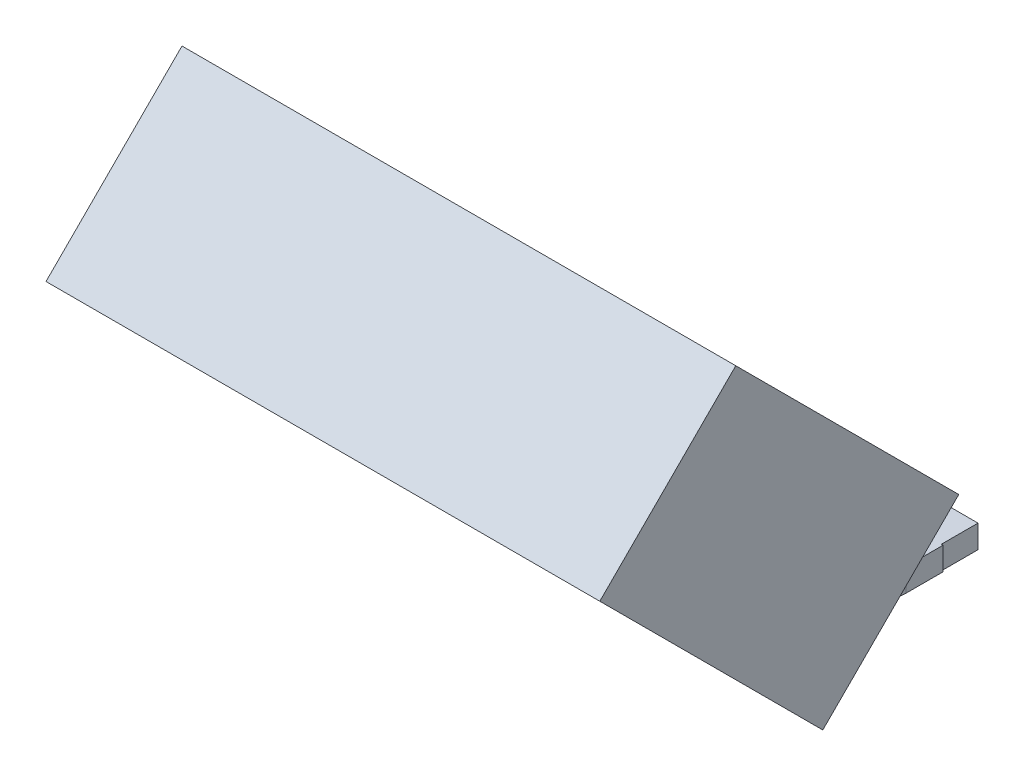
from build123d import *

# Parameters (mm, degrees)
ESQUISSE2_W          = 7.2
ESQUISSE2_H          = 2.5
BOITIER_DEPTH        = 4.1
FENETRECAPTEUR_START = -1.45
ESQUISSE4_R          = 0.8
FENETRECAPTEUR_DEPTH = 0.1
PATTES_DEPTH         = 0.15
PLIAGE_START         = -5
PLIAGE_1_OUTLINE_W   = 7.2
PLIAGE_1_OUTLINE_H   = 4.1
PLIAGE_1_DEPTH       = 4.301040764
PLIAGE_START_2       = -0.698959236
PLIAGE_1_2_OUTLINE_R = 0.8
PLIAGE_1_2_DEPTH     = 0.1
PLIAGE_START_3       = -0.598959236
PLIAGE_1_3_OUTLINE_W = 7.2
PLIAGE_1_3_OUTLINE_H = 4.1
PLIAGE_1_3_DEPTH     = 2.4
PLIAGE_1_4_OUTLINE_W = 7.2
PLIAGE_1_4_OUTLINE_H = 4.1
PLIAGE_1_4_OUTLINE_R = 0.8
PLIAGE_1_4_DEPTH     = 0.1
PLIAGE_START_4       = -3.6
PLIAGE_1_5_DEPTH     = 7.2
PLIAGE_START_5       = -2.813242849
PLIAGE_1_6_DEPTH     = 0.546485698
PLIAGE_START_6       = -1.543242849
PLIAGE_1_7_DEPTH     = 0.546485698
PLIAGE_START_7       = 0.996757151
PLIAGE_1_8_DEPTH     = 0.546485698
PLIAGE_START_8       = 2.266757151
PLIAGE_1_9_DEPTH     = 0.546485698
PLIAGE_START_9       = 0.601040763
PLIAGE_1_10_DEPTH    = 0.300000001


with BuildPart() as part:
    # Esquisse2 → Boitier (new body)
    with BuildSketch(Plane.XY):
        with Locations((0, -0.2)):
            Rectangle(ESQUISSE2_W, ESQUISSE2_H)
    extrude(amount=BOITIER_DEPTH)

    # Esquisse4 → FenetreCapteur (cut)
    with BuildSketch(Plane(origin=(0, 0, 0), x_dir=(1, 0, 0), z_dir=(0, 1, 0)).offset(FENETRECAPTEUR_START)):
        with Locations(Location((-1.27, -2.3, 0), (0, 0, 180))):
            Circle(ESQUISSE4_R)
        with Locations(Location((1.27, -2.3, 0), (0, 0, 180))):
            Circle(ESQUISSE4_R)
    extrude(amount=FENETRECAPTEUR_DEPTH, mode=Mode.SUBTRACT)

    # Esquisse5 → Pattes (add, symmetric)
    with BuildSketch(Plane(origin=(0, 0, 0), x_dir=(1, 0, 0), z_dir=(0, 1, 0))):
        Polygon((2.791437744, 2.2), (2.283797649, 2.2), (2.283797649, 1.724539267), (2.266757151, 1.724539267), (2.266757151, 0.7), (2.002499851, 0), (2.991852509, 0), (2.813242849, 0.7), (2.813242849, 1.724539267), (2.791437744, 1.724539267), align=None)
        Polygon((1.526202351, 2.2), (1.018562256, 2.2), (1.018562256, 1.724539267), (0.996757151, 1.724539267), (0.996757151, 0.7), (0.818147491, 0), (1.807500149, 0), (1.543242849, 0.7), (1.543242849, 1.724539267), (1.526202351, 1.724539267), align=None)
        Polygon((-1.018562256, 2.2), (-1.526202351, 2.2), (-1.526202351, 1.724539267), (-1.543242849, 1.724539267), (-1.543242849, 0.7), (-1.807500149, 0), (-0.818147491, 0), (-0.996757151, 0.7), (-0.996757151, 1.724539267), (-1.018562256, 1.724539267), align=None)
        Polygon((-2.283797649, 2.2), (-2.791437744, 2.2), (-2.791437744, 1.724539267), (-2.813242849, 1.724539267), (-2.813242849, 0.7), (-2.991852509, 0), (-2.002499851, 0), (-2.266757151, 0.7), (-2.266757151, 1.724539267), (-2.283797649, 1.724539267), align=None)
    extrude(amount=PATTES_DEPTH, both=True)

    # Pliage 1: read off the stored shape, not the designer's step
    # Pliage 1 outline → Pliage 1 (cut)
    with BuildSketch(Plane(origin=(0, 0, 0), x_dir=(1, 0, 0), z_dir=(0, 0.707106781186546, -0.707106781186549)).offset(PLIAGE_START)):
        with Locations((0, -2.236827202)):
            Rectangle(PLIAGE_1_OUTLINE_W, PLIAGE_1_OUTLINE_H)
    extrude(amount=PLIAGE_1_DEPTH, mode=Mode.SUBTRACT)

    # Pliage 1 2 outline → Pliage 1 2 (cut)
    with BuildSketch(Plane(origin=(0, 0, 0), x_dir=(1, 0, 0), z_dir=(0, 0.707106781186546, -0.707106781186549)).offset(PLIAGE_START_2)):
        with Locations((-1.27, -2.486827202)):
            Circle(PLIAGE_1_2_OUTLINE_R)
        with Locations((1.27, -2.486827202)):
            Circle(PLIAGE_1_2_OUTLINE_R)
    extrude(amount=PLIAGE_1_2_DEPTH, mode=Mode.SUBTRACT)

    # Pliage 1 3 outline → Pliage 1 3 (add)
    with BuildSketch(Plane(origin=(0, 0, 0), x_dir=(1, 0, 0), z_dir=(0, 0.707106781186546, -0.707106781186549)).offset(PLIAGE_START_3)):
        with Locations((0, -2.236827202)):
            Rectangle(PLIAGE_1_3_OUTLINE_W, PLIAGE_1_3_OUTLINE_H)
    extrude(amount=PLIAGE_1_3_DEPTH)

    # Pliage 1 4 outline → Pliage 1 4 (add)
    with BuildSketch(Plane(origin=(0, 0, 0), x_dir=(1, 0, 0), z_dir=(0, 0.707106781186546, -0.707106781186549)).offset(PLIAGE_START_2)):
        with Locations((0, -2.236827202)):
            Rectangle(PLIAGE_1_4_OUTLINE_W, PLIAGE_1_4_OUTLINE_H)
        with Locations((-1.27, -2.486827202)):
            Circle(PLIAGE_1_4_OUTLINE_R, mode=Mode.SUBTRACT)
        with Locations((1.27, -2.486827202)):
            Circle(PLIAGE_1_4_OUTLINE_R, mode=Mode.SUBTRACT)
    extrude(amount=PLIAGE_1_4_DEPTH)

    # Pliage 1 5 outline → Pliage 1 5 (cut)
    with BuildSketch(Plane.YZ.offset(PLIAGE_START_4)):
        with BuildLine():
            Line((0.021781873, -0.828218127), (0.15, -0.7))
            Line((0.15, -0.7), (0.15, 0))
            Line((0.15, 0), (0.264213563, 0))
            Line((0.264213563, 0), (-1.35, 1.614213563))
            Line((-1.35, 1.614213563), (-1.45, 1.714213563))
            Line((-1.45, 1.714213563), (-1.45, 0))
            Line((-1.45, 0), (-0.15, 0))
            Line((-0.15, 0), (-0.15, -1.242936254))
            ThreePointArc((-0.15, -1.242936254), (-0.105355346, -1.018492421), (0.021781873, -0.828218127))
        make_face()
    extrude(amount=PLIAGE_1_5_DEPTH, mode=Mode.SUBTRACT)

    # Pliage 1 6 outline → Pliage 1 6 (add)
    with BuildSketch(Plane.YZ.offset(PLIAGE_START_5)):
        with BuildLine():
            Line((0.769238816, -0.505025253), (0.557106781, -0.292893218))
            Line((0.557106781, -0.292893218), (0.15, -0.7))
            Line((0.15, -0.7), (0.15, -1.242936254))
            ThreePointArc((0.15, -1.242936254), (0.171808514, -1.133297451), (0.233913907, -1.040350162))
            Line((0.233913907, -1.040350162), (0.769238816, -0.505025253))
        make_face()
    extrude(amount=PLIAGE_1_6_DEPTH)

    # Pliage 1 7 outline → Pliage 1 7 (add)
    with BuildSketch(Plane.YZ.offset(PLIAGE_START_6)):
        with BuildLine():
            Line((0.769238816, -0.505025253), (0.557106781, -0.292893218))
            Line((0.557106781, -0.292893218), (0.15, -0.7))
            Line((0.15, -0.7), (0.15, -1.242936254))
            ThreePointArc((0.15, -1.242936254), (0.171808514, -1.133297451), (0.233913907, -1.040350162))
            Line((0.233913907, -1.040350162), (0.769238816, -0.505025253))
        make_face()
    extrude(amount=PLIAGE_1_7_DEPTH)

    # Pliage 1 8 outline → Pliage 1 8 (add)
    with BuildSketch(Plane.YZ.offset(PLIAGE_START_7)):
        with BuildLine():
            Line((0.769238816, -0.505025253), (0.557106781, -0.292893218))
            Line((0.557106781, -0.292893218), (0.15, -0.7))
            Line((0.15, -0.7), (0.15, -1.242936254))
            ThreePointArc((0.15, -1.242936254), (0.171808514, -1.133297451), (0.233913907, -1.040350162))
            Line((0.233913907, -1.040350162), (0.769238816, -0.505025253))
        make_face()
    extrude(amount=PLIAGE_1_8_DEPTH)

    # Pliage 1 9 outline → Pliage 1 9 (add)
    with BuildSketch(Plane.YZ.offset(PLIAGE_START_8)):
        with BuildLine():
            Line((0.769238816, -0.505025253), (0.557106781, -0.292893218))
            Line((0.557106781, -0.292893218), (0.15, -0.7))
            Line((0.15, -0.7), (0.15, -1.242936254))
            ThreePointArc((0.15, -1.242936254), (0.171808514, -1.133297451), (0.233913907, -1.040350162))
            Line((0.233913907, -1.040350162), (0.769238816, -0.505025253))
        make_face()
    extrude(amount=PLIAGE_1_9_DEPTH)

    # Pliage 1 10 outline → Pliage 1 10 (add)
    with BuildSketch(Plane(origin=(0, 0, 0), x_dir=(1, 0, 0), z_dir=(0, 0.707106781186546, -0.707106781186549)).offset(PLIAGE_START_9)):
        Polygon((2.813242849, 0.513172798), (2.813242849, -0.186827202), (2.991852509, -0.186827202), align=None)
        Polygon((-2.991852509, -0.186827202), (-2.813242849, -0.186827202), (-2.813242849, 0.513172798), align=None)
        Polygon((-2.266757151, -0.186827202), (-2.002499851, -0.186827202), (-2.266757151, 0.513172798), align=None)
        Polygon((-1.807500149, -0.186827202), (-1.543242849, -0.186827202), (-1.543242849, 0.513172798), align=None)
        Polygon((-0.996757151, -0.186827202), (-0.818147491, -0.186827202), (-0.996757151, 0.513172798), align=None)
        Polygon((0.818147491, -0.186827202), (0.996757151, -0.186827202), (0.996757151, 0.513172798), align=None)
        Polygon((1.543242849, -0.186827202), (1.807500149, -0.186827202), (1.543242849, 0.513172798), align=None)
        Polygon((2.266757151, 0.513172798), (2.002499851, -0.186827202), (2.266757151, -0.186827202), align=None)
    extrude(amount=PLIAGE_1_10_DEPTH)


solid = part.part
